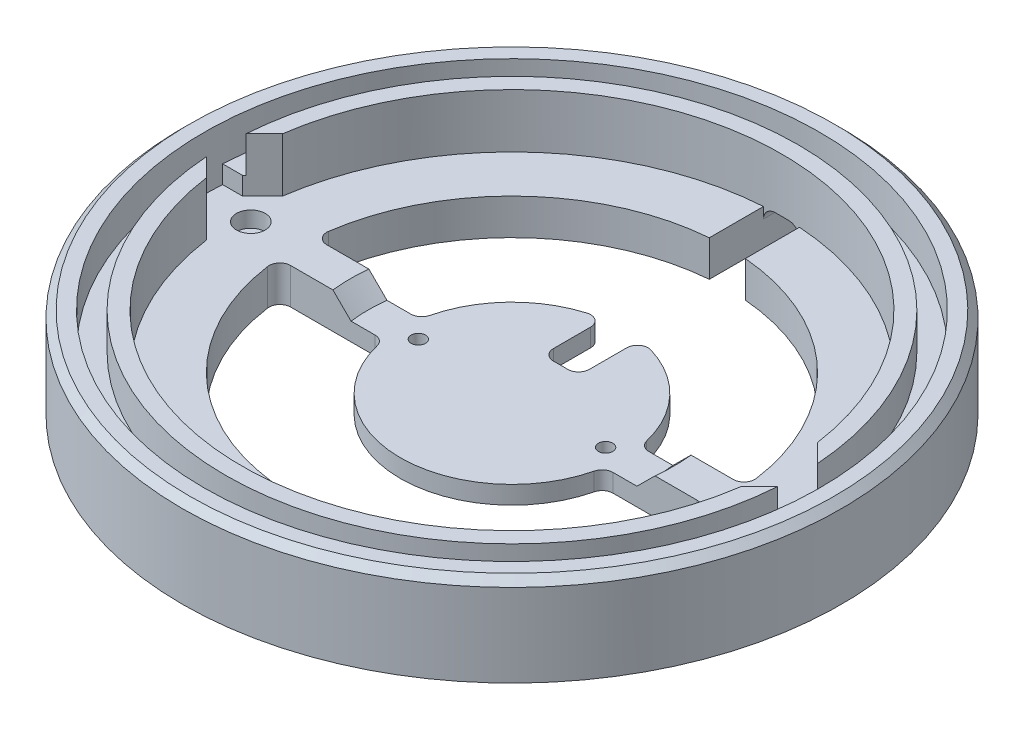
from build123d import *

# Parameters (mm, degrees)
SKETCH1_R                                           = 91.5
BOSS_EXTRUDE1_DEPTH                                 = 10
CUT_EXTRUDE1_DEPTH                                  = 130.78636292
SKETCH3_R                                           = 40
CUT_EXTRUDE2_DEPTH                                  = 5
SKETCH4_R                                           = 91.5
SKETCH4_R_2                                         = 75
BOSS_EXTRUDE2_DEPTH                                 = 5
SKETCH5_R                                           = 91.5
SKETCH5_R_2                                         = 85.5
BOSS_EXTRUDE3_DEPTH                                 = 10
CHAMFER1_SIZE                                       = 2
F_4_5_4_5_DIAMETER_HOLE1_D                          = 4.5
CUT_EXTRUDE3_DEPTH                                  = 91
FILLET1_R                                           = 3
CHAMFER2_SIZE                                       = 5
CHAMFER3_SIZE                                       = 5
SKETCH10_W                                          = 10
SKETCH10_H                                          = 20
CUT_EXTRUDE4_DEPTH                                  = 91
FILLET2_R                                           = 3
FILLET3_R                                           = 3
BOSS_EXTRUDE4_DEPTH                                 = 10
SKETCH12_W                                          = 10
SKETCH12_H                                          = 35
CUT_EXTRUDE5_DEPTH                                  = 10
FILLET4_R                                           = 3
SKETCH13_R                                          = 2
CUT_EXTRUDE6_DEPTH                                  = 10
CBORE_FOR_M4_HEX_SOCKET_HEAD_CAP_SCREW1_D           = 4.5
CBORE_FOR_M4_HEX_SOCKET_HEAD_CAP_SCREW1_CBORE_D     = 8
CBORE_FOR_M4_HEX_SOCKET_HEAD_CAP_SCREW1_CBORE_DEPTH = 4.4


# Some blends are built 0.0001 mm under size
with BuildPart() as part:
    # Sketch1 → Boss-Extrude1 (new body)
    with BuildSketch(Plane(origin=(0, 0, 0), x_dir=(1, 0, 0), z_dir=(0, 1, 0))):
        with Locations(Location((0, 0, 0), (0, 0, 270))):
            Circle(SKETCH1_R)
    extrude(amount=BOSS_EXTRUDE1_DEPTH)

    # Sketch2 → Cut-Extrude1 (cut, through all)
    with BuildSketch(Plane(origin=(0, 10, 0), x_dir=(1, 0, 0), z_dir=(0, 1, 0))):
        with BuildLine():
            ThreePointArc((59.791303716, 5), (0, 60), (-59.791303716, 5))
            Line((-59.791303716, 5), (-30.594117082, 5))
            ThreePointArc((-30.594117082, 5), (0, 31), (30.594117082, 5))
            Line((30.594117082, 5), (59.791303716, 5))
        make_face()
        with BuildLine():
            Line((-30.594117082, -5), (-59.791303716, -5))
            ThreePointArc((-59.791303716, -5), (0, -60), (59.791303716, -5))
            Line((59.791303716, -5), (30.594117082, -5))
            ThreePointArc((30.594117082, -5), (0, -31), (-30.594117082, -5))
        make_face()
    extrude(amount=-CUT_EXTRUDE1_DEPTH, mode=Mode.SUBTRACT)

    # Sketch3 → Cut-Extrude2 (cut)
    with BuildSketch(Plane(origin=(0, 10, 0), x_dir=(1, 0, 0), z_dir=(0, 1, 0))):
        Circle(SKETCH3_R)
    extrude(amount=-CUT_EXTRUDE2_DEPTH, mode=Mode.SUBTRACT)

    # Sketch4 → Boss-Extrude2 (add)
    with BuildSketch(Plane(origin=(0, 10, 0), x_dir=(1, 0, 0), z_dir=(0, 1, 0))):
        with Locations(Location((0, 0, 0), (0, 0, 270))):
            Circle(SKETCH4_R)
        with Locations(Location((0, 0, 0), (0, 0, 270))):
            Circle(SKETCH4_R_2, mode=Mode.SUBTRACT)
    extrude(amount=BOSS_EXTRUDE2_DEPTH)

    # Sketch5 → Boss-Extrude3 (add)
    with BuildSketch(Plane(origin=(0, 15, 0), x_dir=(1, 0, 0), z_dir=(0, 1, 0))):
        with Locations(Location((0, 0, 0), (0, 0, 270))):
            Circle(SKETCH5_R)
        with Locations(Location((0, 0, 0), (0, 0, 270))):
            Circle(SKETCH5_R_2, mode=Mode.SUBTRACT)
    extrude(amount=BOSS_EXTRUDE3_DEPTH)

    # Chamfer1
    chamfer1_edges = [part.edges().sort_by_distance(p)[0] for p in [
        (0, 25, -91.5),
    ]]
    chamfer(chamfer1_edges, length=CHAMFER1_SIZE)

    # Ø4.5 (4.5) Diameter Hole1 (through all)
    with Locations(Plane(origin=(0, 10, 0), x_dir=(1, 0, 0), z_dir=(0, 1, 0))):
        with Locations((-72.5, 0), (72.5, 0)):
            Hole(F_4_5_4_5_DIAMETER_HOLE1_D / 2)

    # Sketch9 → Cut-Extrude3 (cut)
    with BuildSketch(Plane(origin=(0, 10, 0), x_dir=(1, 0, 0), z_dir=(0, 1, 0))):
        with BuildLine():
            Line((-85.353675961, 5), (85.353675961, 5))
            ThreePointArc((85.353675961, 5), (85.5, 0), (85.353675961, -5))
            Line((85.353675961, -5), (-85.353675961, -5))
            ThreePointArc((-85.353675961, -5), (-85.5, 0), (-85.353675961, 5))
        make_face()
    extrude(amount=CUT_EXTRUDE3_DEPTH, mode=Mode.SUBTRACT)

    # Fillet1
    fillet1_edges = [part.edges().sort_by_distance(p)[0] for p in [
        (-59.791303716, 5, -5),
        (59.791303716, 5, -5),
        (59.791303716, 5, 5),
        (-59.791303716, 5, 5),
    ]]
    fillet(fillet1_edges, radius=FILLET1_R)

    # Chamfer2
    chamfer2_edges = [part.edges().sort_by_distance(p)[0] for p in [
        (-40, 10, 0),
        (40, 10, 0),
    ]]
    chamfer(chamfer2_edges, length=CHAMFER2_SIZE - 0.0001)  # a hair under: the kernel refuses the full size

    # Chamfer3
    # the kernel refuses this chamfer: 5.369942673, 5 mm, written as the material it takes off along each edge
    with BuildSketch(Plane(origin=(-74.833147735, 29.456298598, -5), x_dir=(0.10396392346922531, 0, -0.9945810689013164), z_dir=(0, -1, 0))) as chamfer3_piece_1:
        with BuildLine():
            Line((5.614084599, 0), (-CHAMFER3_SIZE * 0.103963923469, -CHAMFER3_SIZE * 0.994581068901))
            Line((-CHAMFER3_SIZE * 0.103963923469, -CHAMFER3_SIZE * 0.994581068901), (0, 0))
            ThreePointArc((0, 0), (2.890602355, -0.05250177), (5.614084599, 0))
        make_face()
    extrude(amount=19.456298598, mode=Mode.SUBTRACT)
    with BuildSketch(Plane(origin=(-74.833147735, 29.456298598, 5), x_dir=(-1, 0, 0), z_dir=(0, -1, 0)), Plane(origin=(74.833147735, 29.456298598, -5), x_dir=(1, 0, 0), z_dir=(0, -1, 0))) as chamfer3_piece_2:
        with BuildLine():
            Line((CHAMFER3_SIZE, 0), (-0.583662262, -5.583662262))
            ThreePointArc((-0.583662262, -5.583662262), (-0.248301095, -2.88039667), (0, 0))
            Line((0, 0), (CHAMFER3_SIZE, 0))
        make_face()
    extrude(amount=19.456298598, mode=Mode.SUBTRACT)
    with BuildSketch(Plane(origin=(74.833147735, 29.456298598, 5), x_dir=(1, 0, 0), z_dir=(0, -1, 0))) as chamfer3_piece_3:
        with BuildLine():
            Line((CHAMFER3_SIZE, 0), (-0.583662262, 5.583662262))
            ThreePointArc((-0.583662262, 5.583662262), (-0.248301095, 2.88039667), (0, 0))
            Line((0, 0), (CHAMFER3_SIZE, 0))
        make_face()
    extrude(amount=19.456298598, mode=Mode.SUBTRACT)

    # Sketch10 → Cut-Extrude4 (cut)
    with BuildSketch(Plane.XY.offset(-40)):
        Rectangle(SKETCH10_W, SKETCH10_H)
    extrude(amount=-CUT_EXTRUDE4_DEPTH, mode=Mode.SUBTRACT)

    # Fillet2
    fillet2_edges = [part.edges().sort_by_distance(p)[0] for p in [
        (5, 10, -83.098216789),
        (-5, 10, -83.098216789),
    ]]
    fillet(fillet2_edges, radius=FILLET2_R)

    # Fillet3
    fillet3_edges = [part.edges().sort_by_distance(p)[0] for p in [
        (-30.594117082, 2.5, -5),
        (-30.594117082, 2.5, 5),
        (30.594117082, 2.5, 5),
        (30.594117082, 2.5, -5),
    ]]
    fillet(fillet3_edges, radius=FILLET3_R)

    # Sketch11 → Boss-Extrude4 (add)
    with BuildSketch(Plane(origin=(0, 15, 0), x_dir=(1, 0, 0), z_dir=(0, 1, 0))):
        with BuildLine():
            Line((-74.249485474, 10.583662262), (-79.307755217, 5.525392519))
            ThreePointArc((-79.307755217, 5.525392519), (0, 79.5), (79.307755217, 5.525392519))
            Line((79.307755217, 5.525392519), (74.249485474, 10.583662262))
            ThreePointArc((74.249485474, 10.583662262), (0, 75), (-74.249485474, 10.583662262))
        make_face()
        with BuildLine():
            Line((-74.249485474, -10.583662262), (-79.307755217, -5.525392519))
            ThreePointArc((-79.307755217, -5.525392519), (0, -79.5), (79.307755217, -5.525392519))
            Line((79.307755217, -5.525392519), (74.249485474, -10.583662262))
            ThreePointArc((74.249485474, -10.583662262), (0, -75), (-74.249485474, -10.583662262))
        make_face()
    extrude(amount=BOSS_EXTRUDE4_DEPTH)

    # Sketch12 → Cut-Extrude5 (cut)
    with BuildSketch(Plane(origin=(0, 5, 0), x_dir=(1, 0, 0), z_dir=(0, 1, 0))):
        with Locations((0, 31)):
            Rectangle(SKETCH12_W, SKETCH12_H)
    extrude(amount=-CUT_EXTRUDE5_DEPTH, mode=Mode.SUBTRACT)

    # Fillet4
    fillet4_edges = [part.edges().sort_by_distance(p)[0] for p in [
        (5, 2.5, -30.594117082),
        (5, 2.5, -13.5),
        (-5, 2.5, -30.594117082),
        (-5, 2.5, -13.5),
    ]]
    fillet(fillet4_edges, radius=FILLET4_R)

    # Sketch13 → Cut-Extrude6 (cut)
    with BuildSketch(Plane(origin=(0, 0, 0), x_dir=(-1, 0, 0), z_dir=(0, -1, 0))):
        with Locations(Location((26, 0, 0), (0, 0, 90))):
            Circle(SKETCH13_R)
        with Locations(Location((-26, 0, 0), (0, 0, 90))):
            Circle(SKETCH13_R)
    extrude(amount=-CUT_EXTRUDE6_DEPTH, mode=Mode.SUBTRACT)

    # CBORE for M4 Hex Socket Head Cap Screw1 (through all)
    with Locations(Plane(origin=(0, 10, 0), x_dir=(1, 0, 0), z_dir=(0, 1, 0))):
        with Locations((-72.5, 0), (72.5, 0)):
            CounterBoreHole(CBORE_FOR_M4_HEX_SOCKET_HEAD_CAP_SCREW1_D / 2, CBORE_FOR_M4_HEX_SOCKET_HEAD_CAP_SCREW1_CBORE_D / 2, CBORE_FOR_M4_HEX_SOCKET_HEAD_CAP_SCREW1_CBORE_DEPTH)


solid = part.part
